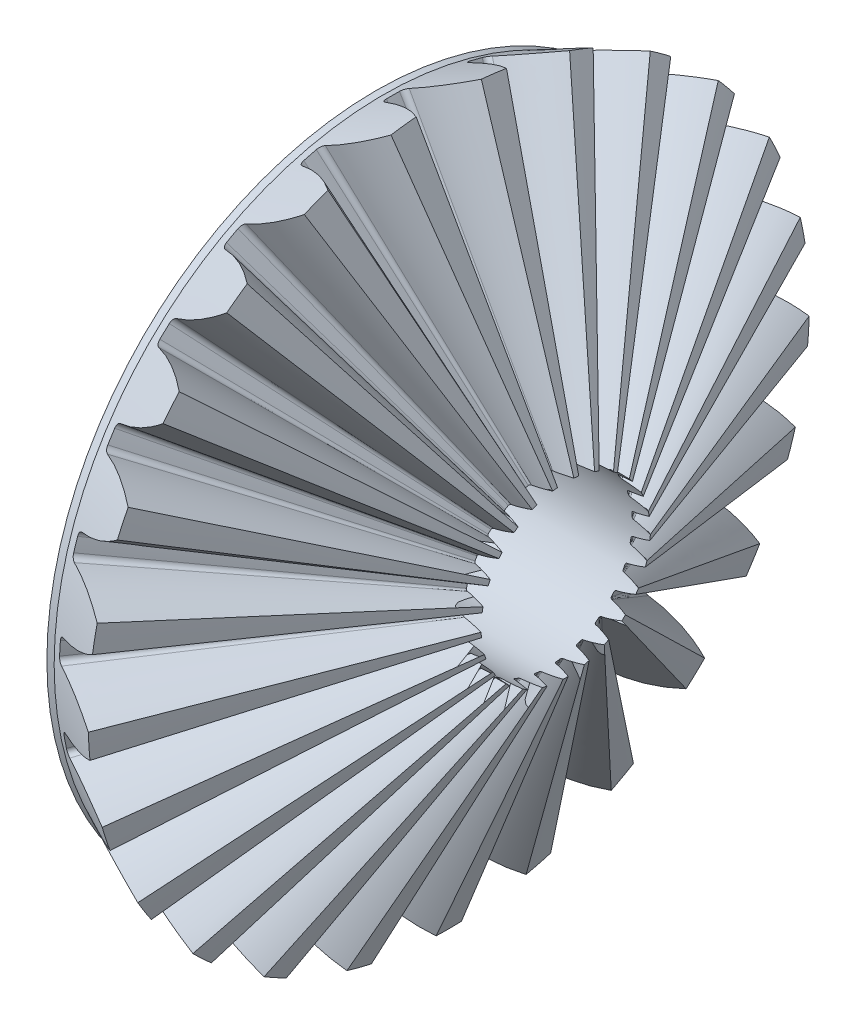
from build123d import *

# Parameters (mm, degrees)
TEETHCUTS_COUNT = 25
TEETHCUTS_ANGLE = 345.6
HUBSKE_R        = 2.915934639
HUB_DEPTH       = 0.064548765
BORSKE_R        = 0.75
BORE_DEPTH      = 2.0000508


with BuildPart() as part:
    # BasProSke → Base-Revolve (revolve)
    with BuildSketch(Plane(origin=(0, 0, 0), x_dir=(1, 0, 0), z_dir=(0, 1, 0)), mode=Mode.PRIVATE) as base_revolve_sk:
        Polygon((0, 0), (0, 2.91593464), (0.581145203, 3.194884336), (1.800112068, 0.319488432), (1.741997548, 0.291593462), (1.741997548, 0), align=None)
    revolve(base_revolve_sk.sketch.rotate(Axis((-10, 0, 0), (1, 0, 0)), 180), axis=Axis((-10, 0, 0), (1, 0, 0)))

    # ToothCut: read off the stored shape, not the designer's step
    # ToothCut: loft between two sections, ruled curve by curve
    toothcut_from = [
        Edge.make_bspline([(1.944262823, 0.004180794, -0.008242996), (1.938725264, 0.001522766, -0.015442413), (1.930220377, -0.00255958, -0.014692337), (1.925777998, -0.004691922, -0.006612754)], [0, 0, 0, 0, 1, 1, 1, 1], 3, [1, 0.724478536, 0.724478536, 1]),
        Edge.make_bspline([(1.925777998, -0.004691922, 0.006612754), (1.930220377, -0.00255958, 0.014692337), (1.938725264, 0.001522766, 0.015442413), (1.944262823, 0.004180794, 0.008242996)], [0, 0, 0, 0, 1, 1, 1, 1], 3, [1, 0.724478536, 0.724478536, 1]),
        Edge.make_bspline([(1.925777998, -0.004691922, -0.006612754), (1.925205905, -0.004966526, -0.00557226), (1.924773789, -0.005173942, -0.004451734), (1.924490528, -0.005309908, -0.003274194)], [0, 0, 0, 0, 1, 1, 1, 1], 3, [1, 0.993152324, 0.993152324, 1]),
        Edge.make_bspline([(1.924490528, -0.005309908, 0.003274194), (1.924773789, -0.005173942, 0.004451734), (1.925205905, -0.004966526, 0.00557226), (1.925777998, -0.004691922, 0.006612754)], [0, 0, 0, 0, 1, 1, 1, 1], 3, [1, 0.993152324, 0.993152324, 1]),
        Edge.make_bspline([(1.924490528, -0.005309908, -0.003274194), (1.923971501, -0.005559041, -0.001116561), (1.923971501, -0.005559041, 0.001116561), (1.924490528, -0.005309908, 0.003274194)], [0, 0, 0, 0, 1, 1, 1, 1], 3, [1, 0.977463665, 0.977463665, 1]),
        Edge.make_line((1.944262823, 0.004180794, 0.008242996), (1.944262823, 0.004180794, -0.008242996)),
    ]
    toothcut_to = [
        Edge.make_bspline([(0.626009682, 3.216419286, -0.326771773), (0.476534658, 3.144671275, -0.208564749), (0.305879892, 3.062756988, -0.133528351), (0.123987634, 2.975448704, -0.106034157)], [0, 0, 0, 0, 1, 1, 1, 1], 3, [1, 0.98058019, 0.98058019, 1]),
        Edge.make_bspline([(0.123987634, 2.975448704, 0.106034157), (0.305879892, 3.062756988, 0.133528351), (0.476534658, 3.144671275, 0.208564749), (0.626009682, 3.216419286, 0.326771773)], [0, 0, 0, 0, 1, 1, 1, 1], 3, [1, 0.98058019, 0.98058019, 1]),
        Edge.make_bspline([(0.123987634, 2.975448704, -0.106034157), (0.101093682, 2.964459607, -0.102573587), (0.086082065, 2.957254031, -0.083090264), (0.086566927, 2.957486765, -0.057466455)], [0, 0, 0, 0, 1, 1, 1, 1], 3, [1, 0.830927748, 0.830927748, 1]),
        Edge.make_bspline([(0.086566927, 2.957486765, 0.057466455), (0.086082065, 2.957254031, 0.083090264), (0.101093682, 2.964459607, 0.102573587), (0.123987634, 2.975448704, 0.106034157)], [0, 0, 0, 0, 1, 1, 1, 1], 3, [1, 0.830927748, 0.830927748, 1]),
        Edge.make_bspline([(0.086566927, 2.957486765, -0.057466455), (0.087291807, 2.957834707, -0.019158297), (0.087291807, 2.957834707, 0.019158297), (0.086566927, 2.957486765, 0.057466455)], [0, 0, 0, 0, 1, 1, 1, 1], 3, [1, 0.999853198, 0.999853198, 1]),
        Edge.make_line((0.626009682, 3.216419286, 0.326771773), (0.626009682, 3.216419286, -0.326771773)),
    ]
    toothcut = Solid(Shell([*[Face.make_surface_from_curves(toothcut_from[k], toothcut_to[k]) for k in range(6)], Face(Wire(toothcut_from)), Face(Wire(toothcut_to))]))
    add(toothcut, mode=Mode.SUBTRACT)

    # TeethCuts: ToothCut ×25 about axis
    teethcuts_axis = Axis((-10, 0, 0), (1, 0, 0))
    for i in range(1, TEETHCUTS_COUNT):
        add(toothcut.rotate(teethcuts_axis, i * TEETHCUTS_ANGLE / (TEETHCUTS_COUNT - 1)), mode=Mode.SUBTRACT)

    # HubSke → Hub (add)
    with BuildSketch(Plane.ZY):
        Circle(HUBSKE_R)
    extrude(amount=HUB_DEPTH)

    # BorSke → Bore (cut, symmetric)
    with BuildSketch(Plane(origin=(0, 0, 0), x_dir=(0, 0, -1), z_dir=(1, 0, 0))):
        with Locations(Location((0, 0, 0), (0, 0, 180))):
            Circle(BORSKE_R)
    extrude(amount=BORE_DEPTH, both=True, mode=Mode.SUBTRACT)


solid = part.part
